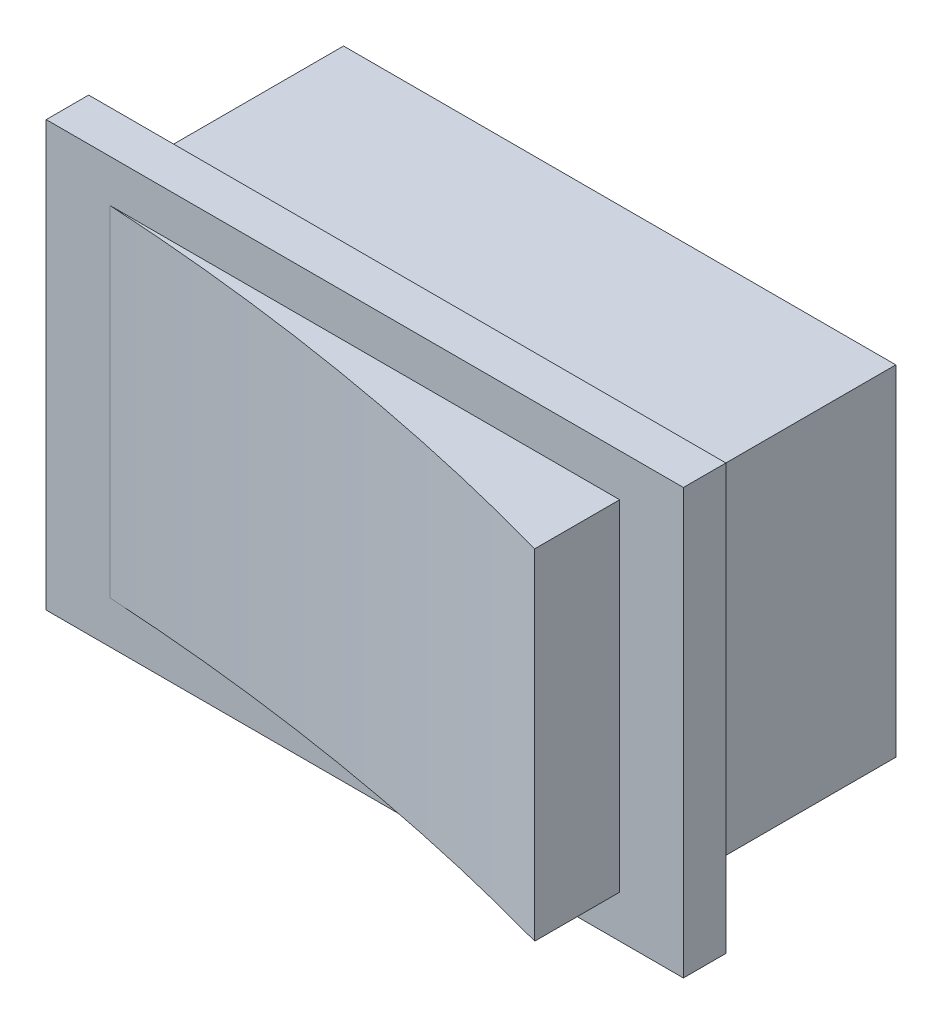
from build123d import *

# Parameters (mm, degrees)
ESBO_O1_W                = 13
ESBO_O1_H                = 8
RESSALTO_EXTRUS_O1_DEPTH = 5
ESBO_O2_W                = 15
ESBO_O2_H                = 10
RESSALTO_EXTRUS_O2_DEPTH = 1
ESBO_O3_W                = 12
ESBO_O3_H                = 8
RESSALTO_EXTRUS_O3_DEPTH = 2
CORTE_EXTRUS_O1_START    = -8
CORTE_EXTRUS_O1_DEPTH    = 8


# Read off the part's stored shape, not the designer's step: Corte-extrusão1
with BuildPart() as part:
    # Esboço1 → Ressalto-extrusão1 (new body)
    with BuildSketch(Plane.XY):
        Rectangle(ESBO_O1_W, ESBO_O1_H)
    extrude(amount=RESSALTO_EXTRUS_O1_DEPTH)

    # Esboço2 → Ressalto-extrusão2 (add)
    with BuildSketch(Plane.XY.offset(5)):
        Rectangle(ESBO_O2_W, ESBO_O2_H)
    extrude(amount=RESSALTO_EXTRUS_O2_DEPTH)

    # Esboço3 → Ressalto-extrusão3 (add)
    with BuildSketch(Plane.XY.offset(6)):
        Rectangle(ESBO_O3_W, ESBO_O3_H)
    extrude(amount=RESSALTO_EXTRUS_O3_DEPTH)

    # Corte-extrusão1 outline → Corte-extrusão1 (cut)
    with BuildSketch(Plane.XZ.offset(4).offset(CORTE_EXTRUS_O1_START)):
        with BuildLine():
            ThreePointArc((-6, 6), (0.053343774, 6.679937356), (6, 8))
            Line((6, 8), (-6, 8))
            Line((-6, 8), (-6, 6))
        make_face()
    extrude(amount=CORTE_EXTRUS_O1_DEPTH, mode=Mode.SUBTRACT)


solid = part.part
